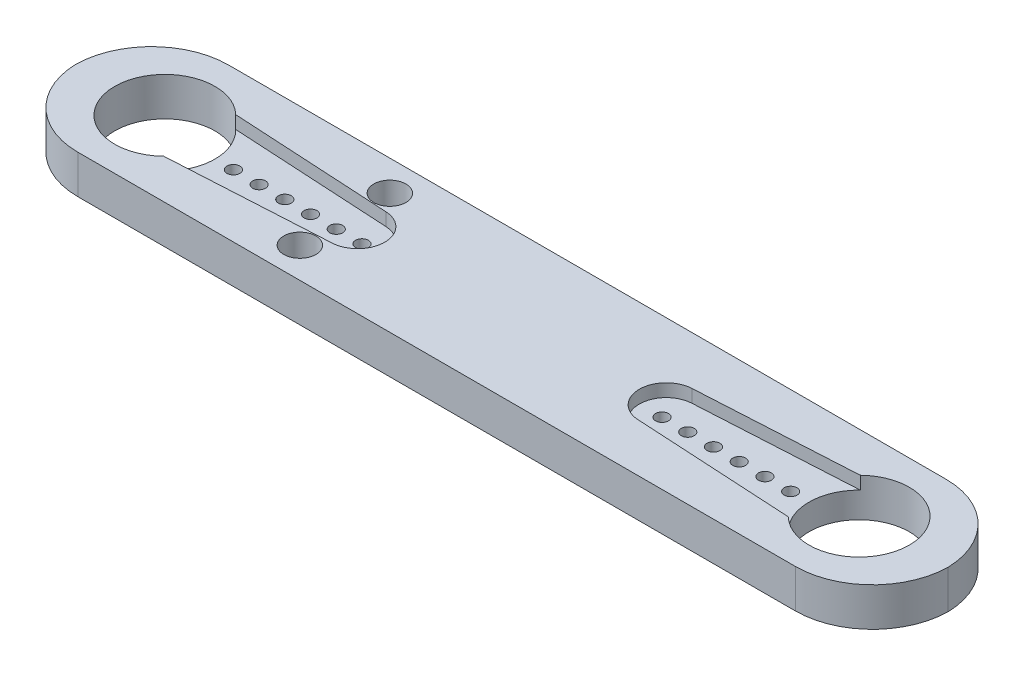
from build123d import *

# Parameters (mm, degrees)
SKETCH1_W           = 67.8
SKETCH1_H           = 11.732307158
SKETCH1_R           = 1.25
BOSS_EXTRUDE1_DEPTH = 3
SKETCH1_7_R         = 0.5
BOSS_EXTRUDE2_DEPTH = 2
FILLET1_R           = 6


with BuildPart() as part:
    # Sketch1 → Boss-Extrude1 (new body)
    with BuildSketch(Plane(origin=(0, 0, 0), x_dir=(1, 0, 0), z_dir=(0, 1, 0))):
        with Locations((8.337190195, 0)):
            Rectangle(SKETCH1_W, SKETCH1_H)
        with Locations(Location((-4.662809805, -3.5, 0), (0, 0, 270))):
            Circle(SKETCH1_R, mode=Mode.SUBTRACT)
        with BuildLine():
            ThreePointArc((-15.948035413, -2.8), (-22.562809805, 0), (-15.948035413, 2.8))
            Line((-15.948035413, 2.8), (-3.54760873, 2.1))
            ThreePointArc((-3.54760873, 2.1), (-1.562809805, 0), (-3.54760873, -2.1))
            Line((-3.54760873, -2.1), (-15.948035413, -2.8))
        make_face(mode=Mode.SUBTRACT)
        with Locations(Location((-4.662809805, 3.5, 0), (0, 0, 270))):
            Circle(SKETCH1_R, mode=Mode.SUBTRACT)
        with BuildLine():
            Line((32.622415803, -2.8), (20.221989119, -2.1))
            ThreePointArc((20.221989119, -2.1), (18.237190195, 0), (20.221989119, 2.1))
            Line((20.221989119, 2.1), (32.622415803, 2.8))
            ThreePointArc((32.622415803, 2.8), (36.85745002, 3.591491343), (39.237190195, 0))
            ThreePointArc((39.237190195, 0), (36.85745002, -3.591491343), (32.622415803, -2.8))
        make_face(mode=Mode.SUBTRACT)
    extrude(amount=BOSS_EXTRUDE1_DEPTH)

    # Sketch1<7> → Boss-Extrude2 (add)
    # profile 1 of 2: a face of its own
    with BuildSketch(Plane(origin=(0, 0, 0), x_dir=(1, 0, 0), z_dir=(0, 1, 0))):
        with BuildLine():
            Line((-3.54760873, 2.1), (-15.948035413, 2.8))
            ThreePointArc((-15.948035413, 2.8), (-15.071318463, 1.520259825), (-14.762809805, 0))
            ThreePointArc((-14.762809805, 0), (-15.071318463, -1.520259825), (-15.948035413, -2.8))
            Line((-15.948035413, -2.8), (-3.54760873, -2.1))
            ThreePointArc((-3.54760873, -2.1), (-1.562809805, 0), (-3.54760873, 2.1))
        make_face()
        with Locations(Location((-13.331400804, 0, 0), (0, 0, 270))):
            Circle(SKETCH1_7_R, mode=Mode.SUBTRACT)
        with Locations(Location((-11.331400804, 0, 0), (0, 0, 270))):
            Circle(SKETCH1_7_R, mode=Mode.SUBTRACT)
        with Locations(Location((-9.331400804, 0, 0), (0, 0, 270))):
            Circle(SKETCH1_7_R, mode=Mode.SUBTRACT)
        with Locations(Location((-7.331400804, 0, 0), (0, 0, 270))):
            Circle(SKETCH1_7_R, mode=Mode.SUBTRACT)
        with Locations(Location((-5.331400804, 0, 0), (0, 0, 270))):
            Circle(SKETCH1_7_R, mode=Mode.SUBTRACT)
        with Locations(Location((-3.331400804, 0, 0), (0, 0, 270))):
            Circle(SKETCH1_7_R, mode=Mode.SUBTRACT)
    # profile 2 of 2: a face of its own
    with BuildSketch(Plane(origin=(0, 0, 0), x_dir=(1, 0, 0), z_dir=(0, 1, 0))):
        with BuildLine():
            ThreePointArc((20.221989119, 2.1), (18.237190195, 0), (20.221989119, -2.1))
            Line((20.221989119, -2.1), (32.622415803, -2.8))
            ThreePointArc((32.622415803, -2.8), (31.437190195, 0), (32.622415803, 2.8))
            Line((32.622415803, 2.8), (20.221989119, 2.1))
        make_face()
        with Locations(Location((22.005781193, 0, 0), (0, 0, 270))):
            Circle(SKETCH1_7_R, mode=Mode.SUBTRACT)
        with Locations(Location((24.005781193, 0, 0), (0, 0, 270))):
            Circle(SKETCH1_7_R, mode=Mode.SUBTRACT)
        with Locations(Location((26.005781193, 0, 0), (0, 0, 270))):
            Circle(SKETCH1_7_R, mode=Mode.SUBTRACT)
        with Locations(Location((28.005781193, 0, 0), (0, 0, 270))):
            Circle(SKETCH1_7_R, mode=Mode.SUBTRACT)
        with Locations(Location((30.005781193, 0, 0), (0, 0, 270))):
            Circle(SKETCH1_7_R, mode=Mode.SUBTRACT)
        with Locations(Location((20.005781193, 0, 0), (0, 0, 270))):
            Circle(SKETCH1_7_R, mode=Mode.SUBTRACT)
    extrude(amount=BOSS_EXTRUDE2_DEPTH)

    # Fillet1
    # the kernel refuses this fillet: 6 mm, written as the material it takes off along each edge
    with BuildSketch(Plane(origin=(-25.562809805, -15, 5.866153579), x_dir=(1, 0, 0), z_dir=(0, 1, 0)), Plane(origin=(42.237190195, -15, -5.866153579), x_dir=(-1, 0, 0), z_dir=(0, 1, 0))) as fillet1_piece_1:
        with BuildLine():
            CenterArc((FILLET1_R, FILLET1_R), FILLET1_R, 180, 90)
            Line((0, FILLET1_R), (0, 0))
            Line((0, 0), (FILLET1_R, 0))
        make_face()
    extrude(amount=33, mode=Mode.SUBTRACT)
    with BuildSketch(Plane(origin=(-25.562809805, -15, -5.866153579), x_dir=(1, 0, 0), z_dir=(0, 1, 0)), Plane(origin=(42.237190195, -15, 5.866153579), x_dir=(-1, 0, 0), z_dir=(0, 1, 0))) as fillet1_piece_2:
        with BuildLine():
            CenterArc((FILLET1_R, -FILLET1_R), FILLET1_R, 90, 90)
            Line((0, -FILLET1_R), (0, 0))
            Line((0, 0), (FILLET1_R, 0))
        make_face()
    extrude(amount=33, mode=Mode.SUBTRACT)


solid = part.part
